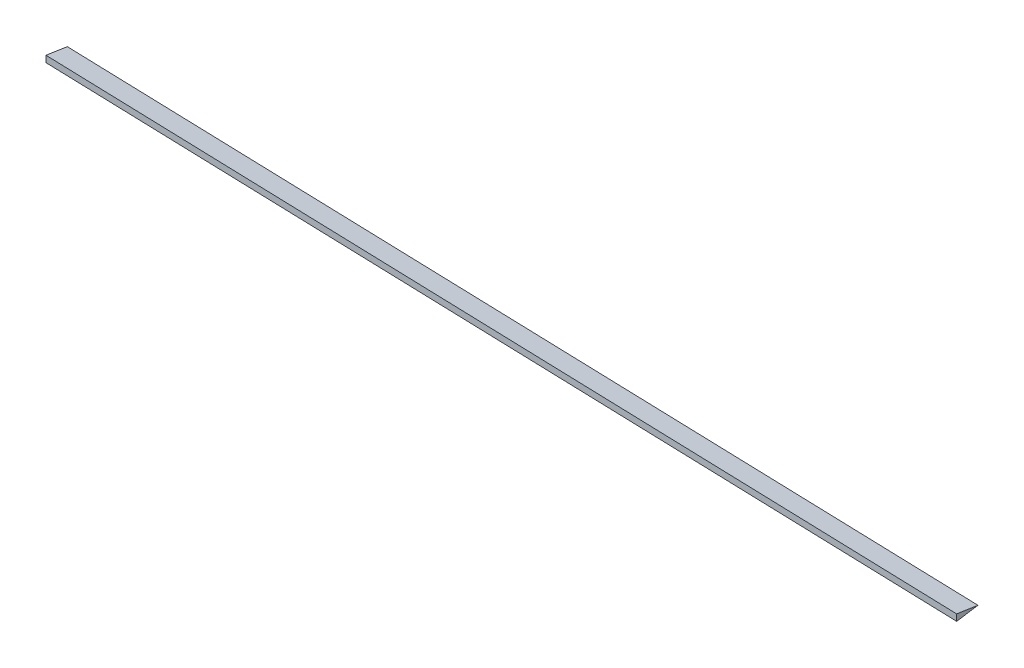
from build123d import *

# Parameters (mm, degrees)
AILERON_DEPTH = 1320.064826377


with BuildPart() as part:
    # aileron_root → aileron (new, along a direction that is not the sketch's normal)
    with BuildSketch(Plane(origin=(0, 0, 0), x_dir=(0, 0, -1), z_dir=(1, 0, 0))):
        Polygon((-30, -4.531071341), (-30, 4.531071341), (0, 0), align=None)
    extrude(amount=AILERON_DEPTH, dir=(0.9995408028416428, 0, 0.03030154211726055))


solid = part.part
